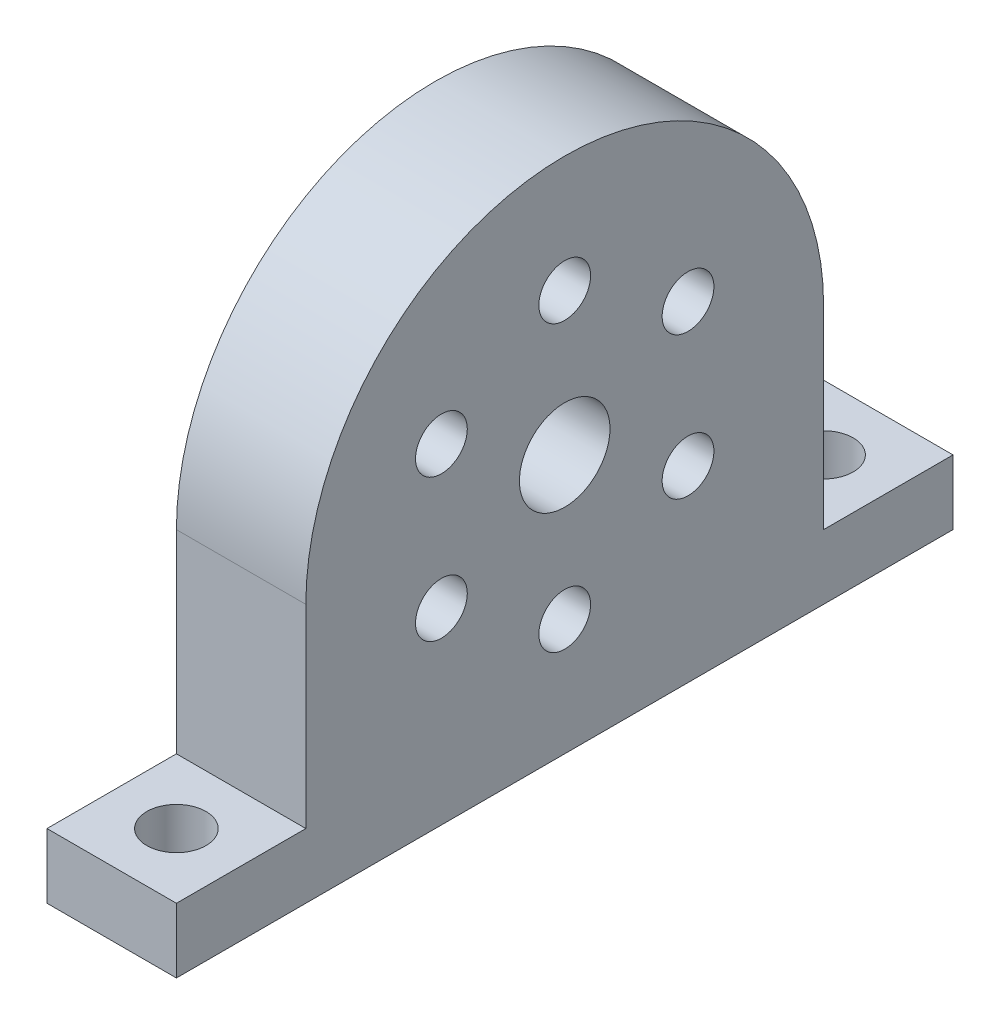
from build123d import *

# Parameters (mm, degrees)
SKETCH1_R                                       = 2
SKETCH1_R_2                                     = 3.5
BOSS_EXTRUDE1_DEPTH                             = 10
F_8_0_18_DIAMETER_HOLE1_D                       = 4.572
CSK_FOR_M2_FLAT_HEAD_MACHINE_SCREW1_D           = 3
CSK_FOR_M2_FLAT_HEAD_MACHINE_SCREW1_CSINK_D     = 5.6
CSK_FOR_M2_FLAT_HEAD_MACHINE_SCREW1_CSINK_ANGLE = 90


with BuildPart() as part:
    # Sketch1 → Boss-Extrude1 (new body)
    with BuildSketch(Plane(origin=(0, 0, 0), x_dir=(0, 0, -1), z_dir=(1, 0, 0))):
        with BuildLine():
            Line((30, -15), (20, -15))
            Line((20, -15), (20, 0))
            ThreePointArc((20, 0), (0, 20), (-20, 0))
            Line((-20, 0), (-20, -15))
            Line((-20, -15), (-30, -15))
            Line((-30, -15), (-30, -20))
            Line((-30, -20), (-22.359912571, -20))
            Line((-22.359912571, -20), (-15.856579477, -20))
            Line((-15.856579477, -20), (9.951007048, -20))
            Line((9.951007048, -20), (17.640087429, -20))
            Line((17.640087429, -20), (30, -20))
            Line((30, -20), (30, -15))
        make_face()
        with Locations((-9.526279442, -5.5)):
            Circle(SKETCH1_R, mode=Mode.SUBTRACT)
        with Locations((0, -11)):
            Circle(SKETCH1_R, mode=Mode.SUBTRACT)
        with Locations((9.526279442, -5.5)):
            Circle(SKETCH1_R, mode=Mode.SUBTRACT)
        with Locations((-9.526279442, 5.5)):
            Circle(SKETCH1_R, mode=Mode.SUBTRACT)
        Circle(SKETCH1_R_2, mode=Mode.SUBTRACT)
        with Locations((9.526279442, 5.5)):
            Circle(SKETCH1_R, mode=Mode.SUBTRACT)
        with Locations((0, 11)):
            Circle(SKETCH1_R, mode=Mode.SUBTRACT)
    extrude(amount=BOSS_EXTRUDE1_DEPTH)

    # #8 (0.18) Diameter Hole1 (through all)
    with Locations(Plane(origin=(5, -15, -25), x_dir=(0, 0, 1), z_dir=(0, 1, 0))):
        with Locations((0, 0), (50, 0)):
            Hole(F_8_0_18_DIAMETER_HOLE1_D / 2)

    # CSK for M2 Flat Head Machine Screw1 (through all)
    with Locations(Plane.ZY):
        with Locations((0, 11), (9.526279442, 5.5), (9.526279442, -5.5), (0, -11), (-9.526279442, -5.5), (-9.526279442, 5.5)):
            CounterSinkHole(CSK_FOR_M2_FLAT_HEAD_MACHINE_SCREW1_D / 2, CSK_FOR_M2_FLAT_HEAD_MACHINE_SCREW1_CSINK_D / 2, counter_sink_angle=CSK_FOR_M2_FLAT_HEAD_MACHINE_SCREW1_CSINK_ANGLE)


solid = part.part
